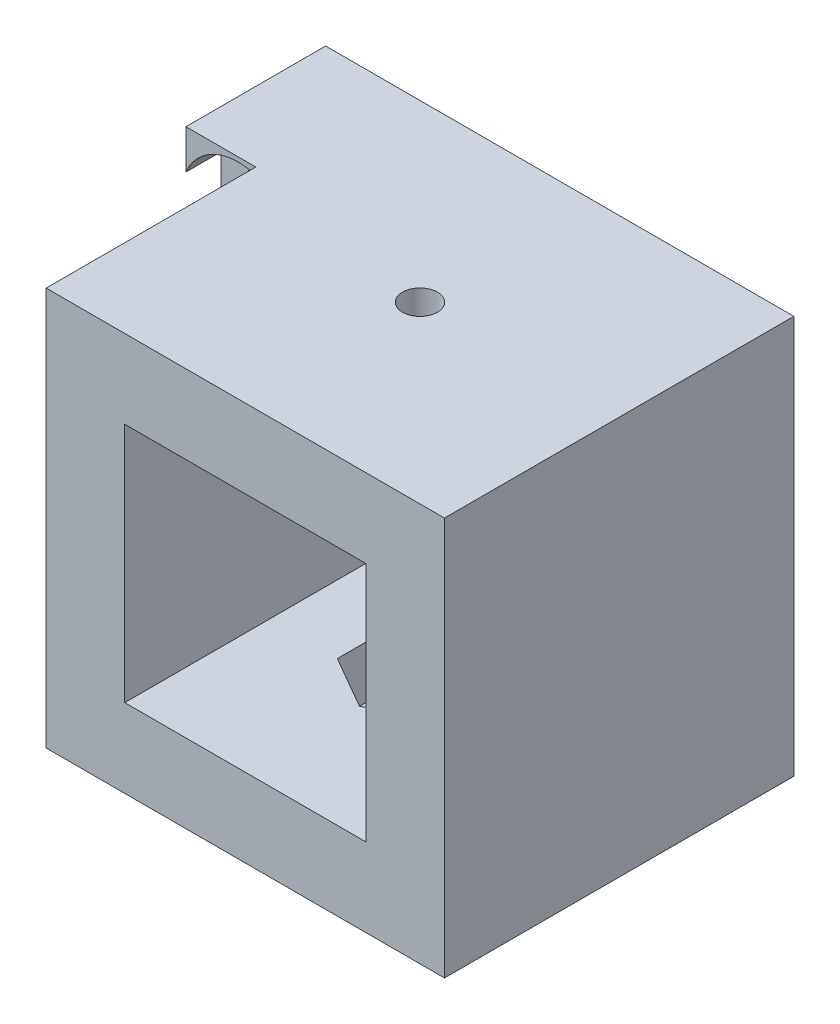
from build123d import *

# Parameters (mm, degrees)
CROQUIS1_W              = 22.8
CROQUIS1_H              = 22.8
CROQUIS1_W_2            = 13.8
CROQUIS1_H_2            = 13.8
SALIENTE_EXTRUIR1_DEPTH = 10
CORTAR_EXTRUIR1_DEPTH   = 3
CROQUIS3_R              = 1.75
CORTAR_EXTRUIR2_DEPTH   = 3
SALIENTE_EXTRUIR3_DEPTH = 8
CROQUIS8_R              = 1.75
CORTAR_EXTRUIR3_DEPTH   = 4
CORTAR_EXTRUIR4_START   = 7
CORTAR_EXTRUIR4_DEPTH   = 7
REDONDEO1_R             = 2.2
REDONDEO5_R             = 3
CROQUIS12_R             = 1
CORTAR_EXTRUIR5_DEPTH   = 10


with BuildPart() as part:
    # Croquis1 → Saliente-Extruir1 (new, symmetric)
    with BuildSketch(Plane.XY):
        Rectangle(CROQUIS1_W, CROQUIS1_H)
        Rectangle(CROQUIS1_W_2, CROQUIS1_H_2, mode=Mode.SUBTRACT)
    extrude(amount=SALIENTE_EXTRUIR1_DEPTH, both=True)

    # Croquis2 → Cortar-Extruir1 (cut)
    with BuildSketch(Plane(origin=(0, -6.9, 0), x_dir=(1, 0, 0), z_dir=(0, 1, 0))):
        Polygon((3, -1.732050808), (3, 1.732050808), (0, 3.464101615), (-3, 1.732050808), (-3, -1.732050808), (0, -3.464101615), align=None)
    extrude(amount=-CORTAR_EXTRUIR1_DEPTH, mode=Mode.SUBTRACT)

    # Croquis3 → Cortar-Extruir2 (cut)
    with BuildSketch(Plane(origin=(0, -9.9, 0), x_dir=(1, 0, 0), z_dir=(0, 1, 0))):
        with Locations(Location((0, 0, 0), (0, 0, 270))):
            Circle(CROQUIS3_R)
    extrude(amount=-CORTAR_EXTRUIR2_DEPTH, mode=Mode.SUBTRACT)

    # Croquis4 → Saliente-Extruir3 (add)
    with BuildSketch(Plane(origin=(0, 0, -10), x_dir=(-1, 0, 0), z_dir=(0, 0, -1))):
        with BuildLine():
            Line((15.4, 11.4), (12.4, 11.4))
            Line((12.4, 11.4), (12.4, 9.65))
            ThreePointArc((12.4, 9.65), (13.637436867, 9.137436867), (14.15, 7.9))
            ThreePointArc((14.15, 7.9), (13.637436867, 6.662563133), (12.4, 6.15))
            Line((12.4, 6.15), (12.4, 4.4))
            Line((12.4, 4.4), (15.4, 4.4))
            Line((15.4, 4.4), (15.4, 11.4))
        make_face()
        with BuildLine():
            Line((12.4, 4.4), (12.4, 6.15))
            ThreePointArc((12.4, 6.15), (11.875951413, 6.23030749), (11.4, 6.463859338))
            Line((11.4, 6.463859338), (11.4, 4.4))
            Line((11.4, 4.4), (12.4, 4.4))
        make_face()
        with BuildLine():
            Line((12.4, 9.65), (12.4, 11.4))
            Line((12.4, 11.4), (11.4, 11.4))
            Line((11.4, 11.4), (11.4, 9.336140662))
            ThreePointArc((11.4, 9.336140662), (11.875951413, 9.56969251), (12.4, 9.65))
        make_face()
    extrude(amount=-SALIENTE_EXTRUIR3_DEPTH)

    # Croquis8 → Cortar-Extruir3 (cut)
    with BuildSketch(Plane(origin=(0, 0, -10), x_dir=(-1, 0, 0), z_dir=(0, 0, -1))):
        with Locations((12.4, 7.9)):
            Circle(CROQUIS8_R)
    extrude(amount=-CORTAR_EXTRUIR3_DEPTH, mode=Mode.SUBTRACT)

    # Croquis9 → Refrentado para tornillo con cabeza plana de M31 (revolve, cut)
    with BuildSketch(Plane(origin=(-12.4, 7.9, -2), x_dir=(0, -1, 0), z_dir=(1, 0, 0))):
        Polygon((0, 0), (0, 8), (1.8, 8), (1.8, 2), (3.25, 2), (3.25, 0), align=None)
    revolve(axis=Axis((-12.4, 7.9, 4.35), (0, 0, -1)), mode=Mode.SUBTRACT)

    # Croquis11 → Cortar-Extruir4 (cut)
    with BuildSketch(Plane.XY.offset(-2).offset(CORTAR_EXTRUIR4_START)):
        with BuildLine():
            Line((-15.4, 9.15), (-15.4, 6.65))
            ThreePointArc((-15.4, 6.65), (-9.15, 7.9), (-15.4, 9.15))
        make_face()
    extrude(amount=-CORTAR_EXTRUIR4_DEPTH, mode=Mode.SUBTRACT)

    # Redondeo1
    redondeo1_edges = [part.edges().sort_by_distance(p)[0] for p in [
        (-15.4, 4.4, -6),
    ]]
    fillet(redondeo1_edges, radius=REDONDEO1_R)

    # Redondeo5
    # the kernel refuses this fillet: 3 mm, written as the material it takes off along each edge
    with BuildSketch(Plane(origin=(-11.4, 18.492329219, 5), x_dir=(0, 0, 1), z_dir=(0, -1, 0))) as redondeo5_piece_1_section:
        with BuildLine():
            CenterArc((REDONDEO5_R, -REDONDEO5_R), REDONDEO5_R, 90, 90)
            Line((0, -REDONDEO5_R), (0, 0))
            Line((0, 0), (REDONDEO5_R, 0))
        make_face()
    redondeo5_piece_1 = extrude(amount=21.184658438, mode=Mode.PRIVATE)
    redondeo5_piece_1 = redondeo5_piece_1 & Plane(origin=(-12.4, 7.9, 5.75686285), x_dir=(-0.923076923076923, -0.3846153846153848, 0), z_dir=(0, 0, 1)) * Cylinder(3.25, 55, mode=Mode.PRIVATE)
    add(redondeo5_piece_1, mode=Mode.SUBTRACT)

    # Croquis12 → Cortar-Extruir5 (cut)
    with BuildSketch(Plane(origin=(0, 11.4, 0), x_dir=(1, 0, 0), z_dir=(0, 1, 0))):
        with Locations(Location((0, 0, 0), (0, 0, 270))):
            Circle(CROQUIS12_R)
    extrude(amount=-CORTAR_EXTRUIR5_DEPTH, mode=Mode.SUBTRACT)


solid = part.part
